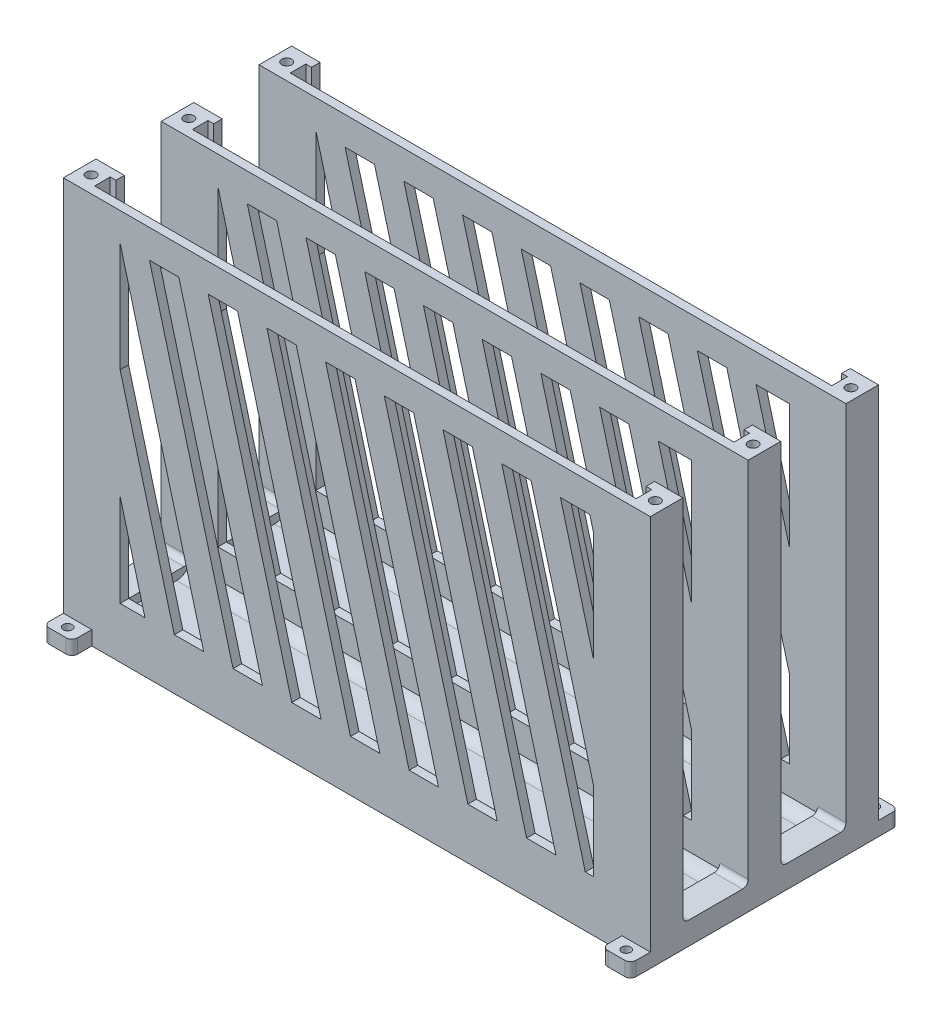
from build123d import *

# Parameters (mm, degrees)
SKETCH1_W           = 187
SKETCH1_H           = 3
SKETCH1_W_2         = 10
SKETCH1_H_2         = 23
BOSS_EXTRUDE1_DEPTH = 3.2
BOSS_EXTRUDE2_DEPTH = 130
BOSS_EXTRUDE3_START = -3
SKETCH1_5_W         = 187
SKETCH1_5_H         = 3
SKETCH1_5_W_2       = 10
SKETCH1_5_H_2       = 23
SKETCH1_5_R         = 1.6
BOSS_EXTRUDE3_DEPTH = 5
FILLET1_R           = 5
SKETCH2_R           = 1.75
CUT_EXTRUDE1_DEPTH  = 5
FILLET2_R           = 2
BOSS_EXTRUDE4_START = -3
SKETCH3_W           = 187
SKETCH3_H           = 130
BOSS_EXTRUDE4_DEPTH = 3
BOSS_EXTRUDE5_DEPTH = 3
LPATTERN1_COUNT     = 2
LPATTERN1_PITCH     = 34.5


with BuildPart() as part:
    # Sketch1 → Boss-Extrude1 (new body)
    with BuildSketch(Plane(origin=(0, 0, 0), x_dir=(1, 0, 0), z_dir=(0, 1, 0))):
        Polygon((-103.5, -74.75), (-93.5, -74.75), (-93.5, -71.75), (-95.5, -71.75), (-95.5, -66.25), (-93.5, -66.25), (-93.5, -63.25), (-103.5, -63.25), align=None)
        with Locations((0, -73.25)):
            Rectangle(SKETCH1_W, SKETCH1_H)
        with Locations((0, -64.75)):
            Rectangle(SKETCH1_W, SKETCH1_H)
        with Locations((0, -38.75)):
            Rectangle(SKETCH1_W, SKETCH1_H)
        Polygon((-103.5, -40.25), (-93.5, -40.25), (-93.5, -37.25), (-95.5, -37.25), (-95.5, -31.75), (-93.5, -31.75), (-93.5, -28.75), (-103.5, -28.75), align=None)
        with Locations((0, -30.25)):
            Rectangle(SKETCH1_W, SKETCH1_H)
        with Locations((0, -4.25)):
            Rectangle(SKETCH1_W, SKETCH1_H)
        with Locations((0, 4.25)):
            Rectangle(SKETCH1_W, SKETCH1_H)
        Polygon((93.5, -2.75), (95.5, -2.75), (95.5, 2.75), (93.5, 2.75), (93.5, 5.75), (103.5, 5.75), (103.5, -5.75), (93.5, -5.75), align=None)
        Polygon((103.5, -40.25), (93.5, -40.25), (93.5, -37.25), (95.5, -37.25), (95.5, -31.75), (93.5, -31.75), (93.5, -28.75), (103.5, -28.75), align=None)
        Polygon((103.5, -74.75), (93.5, -74.75), (93.5, -71.75), (95.5, -71.75), (95.5, -66.25), (93.5, -66.25), (93.5, -63.25), (103.5, -63.25), align=None)
        Polygon((-93.5, -5.75), (-93.5, -2.75), (-95.5, -2.75), (-95.5, 2.75), (-93.5, 2.75), (-93.5, 5.75), (-103.5, 5.75), (-103.5, -5.75), align=None)
        with Locations((-98.5, -51.75)):
            Rectangle(SKETCH1_W_2, SKETCH1_H_2)
        with Locations((-98.5, -17.25)):
            Rectangle(SKETCH1_W_2, SKETCH1_H_2)
        with Locations((98.5, -51.75)):
            Rectangle(SKETCH1_W_2, SKETCH1_H_2)
        with Locations((98.5, -17.25)):
            Rectangle(SKETCH1_W_2, SKETCH1_H_2)
    extrude(amount=-BOSS_EXTRUDE1_DEPTH)

    # Sketch1<4> → Boss-Extrude2 (add)
    with BuildSketch(Plane(origin=(0, 0, 0), x_dir=(1, 0, 0), z_dir=(0, 1, 0))):
        Polygon((-103.5, -74.75), (-93.5, -74.75), (-93.5, -71.75), (-95.5, -71.75), (-95.5, -66.25), (-93.5, -66.25), (-93.5, -63.25), (-103.5, -63.25), align=None)
        Polygon((-103.5, -40.25), (-93.5, -40.25), (-93.5, -37.25), (-95.5, -37.25), (-95.5, -31.75), (-93.5, -31.75), (-93.5, -28.75), (-103.5, -28.75), align=None)
        Polygon((-93.5, -5.75), (-93.5, -2.75), (-95.5, -2.75), (-95.5, 2.75), (-93.5, 2.75), (-93.5, 5.75), (-103.5, 5.75), (-103.5, -5.75), align=None)
        Polygon((103.5, -74.75), (93.5, -74.75), (93.5, -71.75), (95.5, -71.75), (95.5, -66.25), (93.5, -66.25), (93.5, -63.25), (103.5, -63.25), align=None)
        Polygon((103.5, -40.25), (93.5, -40.25), (93.5, -37.25), (95.5, -37.25), (95.5, -31.75), (93.5, -31.75), (93.5, -28.75), (103.5, -28.75), align=None)
        Polygon((93.5, -2.75), (95.5, -2.75), (95.5, 2.75), (93.5, 2.75), (93.5, 5.75), (103.5, 5.75), (103.5, -5.75), (93.5, -5.75), align=None)
    extrude(amount=BOSS_EXTRUDE2_DEPTH)

    # Sketch1<5> → Boss-Extrude3 (add)
    # profile 1 of 25: a face of its own
    with BuildSketch(Plane(origin=(0, 0, 0), x_dir=(1, 0, 0), z_dir=(0, 1, 0)).offset(BOSS_EXTRUDE3_START)):
        Polygon((-103.5, -74.75), (-93.5, -74.75), (-93.5, -71.75), (-95.5, -71.75), (-95.5, -66.25), (-93.5, -66.25), (-93.5, -63.25), (-103.5, -63.25), align=None)
    # profile 2 of 25: a face of its own
    with BuildSketch(Plane(origin=(0, 0, 0), x_dir=(1, 0, 0), z_dir=(0, 1, 0)).offset(BOSS_EXTRUDE3_START)):
        with Locations((0, -73.25)):
            Rectangle(SKETCH1_5_W, SKETCH1_5_H)
    # profile 3 of 25: a face of its own
    with BuildSketch(Plane(origin=(0, 0, 0), x_dir=(1, 0, 0), z_dir=(0, 1, 0)).offset(BOSS_EXTRUDE3_START)):
        Polygon((-93.5, -71.75), (-95.5, -71.75), (-95.5, -66.25), (-93.5, -66.25), (93.5, -66.25), (95.5, -66.25), (95.5, -71.75), (93.5, -71.75), align=None)
    # profile 4 of 25: a face of its own
    with BuildSketch(Plane(origin=(0, 0, 0), x_dir=(1, 0, 0), z_dir=(0, 1, 0)).offset(BOSS_EXTRUDE3_START)):
        with Locations((0, -64.75)):
            Rectangle(SKETCH1_5_W, SKETCH1_5_H)
    # profile 5 of 25: a face of its own
    with BuildSketch(Plane(origin=(0, 0, 0), x_dir=(1, 0, 0), z_dir=(0, 1, 0)).offset(BOSS_EXTRUDE3_START)):
        with Locations((-98.5, -51.75)):
            Rectangle(SKETCH1_5_W_2, SKETCH1_5_H_2)
    # profile 6 of 25: a face of its own
    with BuildSketch(Plane(origin=(0, 0, 0), x_dir=(1, 0, 0), z_dir=(0, 1, 0)).offset(BOSS_EXTRUDE3_START)):
        Polygon((-103.5, -40.25), (-93.5, -40.25), (-93.5, -37.25), (-95.5, -37.25), (-95.5, -31.75), (-93.5, -31.75), (-93.5, -28.75), (-103.5, -28.75), align=None)
    # profile 7 of 25: a face of its own
    with BuildSketch(Plane(origin=(0, 0, 0), x_dir=(1, 0, 0), z_dir=(0, 1, 0)).offset(BOSS_EXTRUDE3_START)):
        with Locations((0, -38.75)):
            Rectangle(SKETCH1_5_W, SKETCH1_5_H)
    # profile 8 of 25: a face of its own
    with BuildSketch(Plane(origin=(0, 0, 0), x_dir=(1, 0, 0), z_dir=(0, 1, 0)).offset(BOSS_EXTRUDE3_START)):
        with Locations((0, -30.25)):
            Rectangle(SKETCH1_5_W, SKETCH1_5_H)
    # profile 9 of 25: a face of its own
    with BuildSketch(Plane(origin=(0, 0, 0), x_dir=(1, 0, 0), z_dir=(0, 1, 0)).offset(BOSS_EXTRUDE3_START)):
        with Locations((-98.5, -17.25)):
            Rectangle(SKETCH1_5_W_2, SKETCH1_5_H_2)
    # profile 10 of 25: a face of its own
    with BuildSketch(Plane(origin=(0, 0, 0), x_dir=(1, 0, 0), z_dir=(0, 1, 0)).offset(BOSS_EXTRUDE3_START)):
        Polygon((-93.5, -5.75), (-93.5, -2.75), (-95.5, -2.75), (-95.5, 2.75), (-93.5, 2.75), (-93.5, 5.75), (-103.5, 5.75), (-103.5, -5.75), align=None)
    # profile 11 of 25: a face of its own
    with BuildSketch(Plane(origin=(0, 0, 0), x_dir=(1, 0, 0), z_dir=(0, 1, 0)).offset(BOSS_EXTRUDE3_START)):
        with Locations((0, -4.25)):
            Rectangle(SKETCH1_5_W, SKETCH1_5_H)
    # profile 12 of 25: a face of its own
    with BuildSketch(Plane(origin=(0, 0, 0), x_dir=(1, 0, 0), z_dir=(0, 1, 0)).offset(BOSS_EXTRUDE3_START)):
        with Locations((0, 4.25)):
            Rectangle(SKETCH1_5_W, SKETCH1_5_H)
    # profile 13 of 25: a face of its own
    with BuildSketch(Plane(origin=(0, 0, 0), x_dir=(1, 0, 0), z_dir=(0, 1, 0)).offset(BOSS_EXTRUDE3_START)):
        Polygon((93.5, -2.75), (95.5, -2.75), (95.5, 2.75), (93.5, 2.75), (93.5, 5.75), (103.5, 5.75), (103.5, -5.75), (93.5, -5.75), align=None)
    # profile 14 of 25: a face of its own
    with BuildSketch(Plane(origin=(0, 0, 0), x_dir=(1, 0, 0), z_dir=(0, 1, 0)).offset(BOSS_EXTRUDE3_START)):
        with Locations((98.5, -17.25)):
            Rectangle(SKETCH1_5_W_2, SKETCH1_5_H_2)
    # profile 15 of 25: a face of its own
    with BuildSketch(Plane(origin=(0, 0, 0), x_dir=(1, 0, 0), z_dir=(0, 1, 0)).offset(BOSS_EXTRUDE3_START)):
        Polygon((103.5, -40.25), (93.5, -40.25), (93.5, -37.25), (95.5, -37.25), (95.5, -31.75), (93.5, -31.75), (93.5, -28.75), (103.5, -28.75), align=None)
    # profile 16 of 25: a face of its own
    with BuildSketch(Plane(origin=(0, 0, 0), x_dir=(1, 0, 0), z_dir=(0, 1, 0)).offset(BOSS_EXTRUDE3_START)):
        with Locations((98.5, -51.75)):
            Rectangle(SKETCH1_5_W_2, SKETCH1_5_H_2)
    # profile 17 of 25: a face of its own
    with BuildSketch(Plane(origin=(0, 0, 0), x_dir=(1, 0, 0), z_dir=(0, 1, 0)).offset(BOSS_EXTRUDE3_START)):
        Polygon((103.5, -74.75), (93.5, -74.75), (93.5, -71.75), (95.5, -71.75), (95.5, -66.25), (93.5, -66.25), (93.5, -63.25), (103.5, -63.25), align=None)
    # profile 18 of 25: a face of its own
    with BuildSketch(Plane(origin=(0, 0, 0), x_dir=(1, 0, 0), z_dir=(0, 1, 0)).offset(BOSS_EXTRUDE3_START)):
        Polygon((-93.5, -37.25), (-95.5, -37.25), (-95.5, -31.75), (-93.5, -31.75), (93.5, -31.75), (95.5, -31.75), (95.5, -37.25), (93.5, -37.25), align=None)
    # profile 19 of 25: a face of its own
    with BuildSketch(Plane(origin=(0, 0, 0), x_dir=(1, 0, 0), z_dir=(0, 1, 0)).offset(BOSS_EXTRUDE3_START)):
        Polygon((95.5, 2.75), (93.5, 2.75), (-93.5, 2.75), (-95.5, 2.75), (-95.5, -2.75), (-93.5, -2.75), (93.5, -2.75), (95.5, -2.75), align=None)
    # profile 20 of 25: a face of its own
    with BuildSketch(Plane(origin=(0, 0, 0), x_dir=(1, 0, 0), z_dir=(0, 1, 0)).offset(BOSS_EXTRUDE3_START)):
        with Locations((0, -51.75)):
            Rectangle(SKETCH1_5_W, SKETCH1_5_H_2)
    # profile 21 of 25: a face of its own
    with BuildSketch(Plane(origin=(0, 0, 0), x_dir=(1, 0, 0), z_dir=(0, 1, 0)).offset(BOSS_EXTRUDE3_START)):
        with Locations((0, -17.25)):
            Rectangle(SKETCH1_5_W, SKETCH1_5_H_2)
    # profile 22 of 25: a face of its own
    with BuildSketch(Plane(origin=(0, 0, 0), x_dir=(1, 0, 0), z_dir=(0, 1, 0)).offset(BOSS_EXTRUDE3_START)):
        with BuildLine():
            ThreePointArc((-101.5, -81.75), (-102.914213562, -81.164213562), (-103.5, -79.75))
            Line((-103.5, -79.75), (-103.5, -74.75))
            Line((-103.5, -74.75), (-93.5, -74.75))
            Line((-93.5, -74.75), (-93.5, -79.75))
            ThreePointArc((-93.5, -79.75), (-94.085786438, -81.164213562), (-95.5, -81.75))
            Line((-95.5, -81.75), (-101.5, -81.75))
        make_face()
        with Locations(Location((-98.5, -78.25, 0), (0, 0, 270))):
            Circle(SKETCH1_5_R, mode=Mode.SUBTRACT)
    # profile 23 of 25: a face of its own
    with BuildSketch(Plane(origin=(0, 0, 0), x_dir=(1, 0, 0), z_dir=(0, 1, 0)).offset(BOSS_EXTRUDE3_START)):
        with BuildLine():
            ThreePointArc((95.5, -81.75), (94.085786438, -81.164213562), (93.5, -79.75))
            Line((93.5, -79.75), (93.5, -74.75))
            Line((93.5, -74.75), (103.5, -74.75))
            Line((103.5, -74.75), (103.5, -79.75))
            ThreePointArc((103.5, -79.75), (102.914213562, -81.164213562), (101.5, -81.75))
            Line((101.5, -81.75), (95.5, -81.75))
        make_face()
        with Locations(Location((98.5, -78.25, 0), (0, 0, 270))):
            Circle(SKETCH1_5_R, mode=Mode.SUBTRACT)
    # profile 24 of 25: a face of its own
    with BuildSketch(Plane(origin=(0, 0, 0), x_dir=(1, 0, 0), z_dir=(0, 1, 0)).offset(BOSS_EXTRUDE3_START)):
        with BuildLine():
            Line((103.5, 5.75), (103.5, 10.75))
            ThreePointArc((103.5, 10.75), (102.914213562, 12.164213562), (101.5, 12.75))
            Line((101.5, 12.75), (95.5, 12.75))
            ThreePointArc((95.5, 12.75), (94.085786438, 12.164213562), (93.5, 10.75))
            Line((93.5, 10.75), (93.5, 5.75))
            Line((93.5, 5.75), (103.5, 5.75))
        make_face()
        with Locations(Location((98.5, 9.25, 0), (0, 0, 270))):
            Circle(SKETCH1_5_R, mode=Mode.SUBTRACT)
    # profile 25 of 25: a face of its own
    with BuildSketch(Plane(origin=(0, 0, 0), x_dir=(1, 0, 0), z_dir=(0, 1, 0)).offset(BOSS_EXTRUDE3_START)):
        with BuildLine():
            ThreePointArc((-103.5, 10.75), (-102.914213562, 12.164213562), (-101.5, 12.75))
            Line((-101.5, 12.75), (-95.5, 12.75))
            ThreePointArc((-95.5, 12.75), (-94.085786438, 12.164213562), (-93.5, 10.75))
            Line((-93.5, 10.75), (-93.5, 5.75))
            Line((-93.5, 5.75), (-103.5, 5.75))
            Line((-103.5, 5.75), (-103.5, 10.75))
        make_face()
        with Locations(Location((-98.5, 9.25, 0), (0, 0, 270))):
            Circle(SKETCH1_5_R, mode=Mode.SUBTRACT)
    extrude(amount=-BOSS_EXTRUDE3_DEPTH)

    # Fillet1
    # the kernel refuses this fillet: 5 mm, written as the material it adds along each edge
    with BuildSketch(Plane(origin=(-104.956439237, -3, 5.75), x_dir=(0, 0, 1), z_dir=(1, 0, 0))) as fillet1_piece_1_section:
        with BuildLine():
            CenterArc((4.582575695, -5), FILLET1_R, 90, 66.421821522)
            Line((0, -3), (-0.091651514, -2.96))
            ThreePointArc((-0.091651514, -2.96), (-0.1, -1.5), (-0.1, 0))
            Line((-0.1, 0), (0, 0.1))
            Line((0, 0.1), (4.582575695, 0.1))
            Line((4.582575695, 0.1), (4.582575695, 0))
        make_face()
    fillet1_piece_1 = extrude(amount=209.912878475, mode=Mode.PRIVATE)
    fillet1_piece_1 = split(fillet1_piece_1, bisect_by=Plane(origin=(-103.5, -2.224183561, 6.865937721), z_dir=(1, 0, 0)), keep=Keep.TOP, mode=Mode.PRIVATE)
    fillet1_piece_1 = split(fillet1_piece_1, bisect_by=Plane(origin=(103.5, -2.224183561, 6.865937721), z_dir=(-1, 0, 0)), keep=Keep.TOP, mode=Mode.PRIVATE)
    add(fillet1_piece_1)
    with BuildSketch(Plane(origin=(-104.956439237, -3, 40.25), x_dir=(0, 0, 1), z_dir=(1, 0, 0))) as fillet1_piece_2_section:
        with BuildLine():
            CenterArc((4.582575695, -5), FILLET1_R, 90, 66.421821522)
            Line((0, -3), (-0.091651514, -2.96))
            ThreePointArc((-0.091651514, -2.96), (-0.1, -1.5), (-0.1, 0))
            Line((-0.1, 0), (0, 0.1))
            Line((0, 0.1), (4.582575695, 0.1))
            Line((4.582575695, 0.1), (4.582575695, 0))
        make_face()
    fillet1_piece_2 = extrude(amount=209.912878475, mode=Mode.PRIVATE)
    fillet1_piece_2 = split(fillet1_piece_2, bisect_by=Plane(origin=(-103.5, -2.224183561, 41.365937721), z_dir=(1, 0, 0)), keep=Keep.TOP, mode=Mode.PRIVATE)
    fillet1_piece_2 = split(fillet1_piece_2, bisect_by=Plane(origin=(103.5, -2.224183561, 41.365937721), z_dir=(-1, 0, 0)), keep=Keep.TOP, mode=Mode.PRIVATE)
    add(fillet1_piece_2)
    with BuildSketch(Plane(origin=(-104.956439237, -3, 28.75), x_dir=(0, 1, 0), z_dir=(1, 0, 0))) as fillet1_piece_3_section:
        with BuildLine():
            CenterArc((5, -4.582575695), FILLET1_R, 113.578178478, 66.421821522)
            Line((0, -4.582575695), (-0.1, -4.582575695))
            Line((-0.1, -4.582575695), (-0.1, 0))
            Line((-0.1, 0), (0, 0.1))
            ThreePointArc((0, 0.1), (1.5, 0.1), (2.96, 0.091651514))
            Line((2.96, 0.091651514), (3, 0))
        make_face()
    fillet1_piece_3 = extrude(amount=209.912878475, mode=Mode.PRIVATE)
    fillet1_piece_3 = split(fillet1_piece_3, bisect_by=Plane(origin=(-103.5, -2.224183561, 27.634062279), z_dir=(1, 0, 0)), keep=Keep.TOP, mode=Mode.PRIVATE)
    fillet1_piece_3 = split(fillet1_piece_3, bisect_by=Plane(origin=(103.5, -2.224183561, 27.634062279), z_dir=(-1, 0, 0)), keep=Keep.TOP, mode=Mode.PRIVATE)
    add(fillet1_piece_3)
    with BuildSketch(Plane(origin=(-104.956439237, -3, 63.25), x_dir=(0, 1, 0), z_dir=(1, 0, 0))) as fillet1_piece_4_section:
        with BuildLine():
            CenterArc((5, -4.582575695), FILLET1_R, 113.578178478, 66.421821522)
            Line((0, -4.582575695), (-0.1, -4.582575695))
            Line((-0.1, -4.582575695), (-0.1, 0))
            Line((-0.1, 0), (0, 0.1))
            ThreePointArc((0, 0.1), (1.5, 0.1), (2.96, 0.091651514))
            Line((2.96, 0.091651514), (3, 0))
        make_face()
    fillet1_piece_4 = extrude(amount=209.912878475, mode=Mode.PRIVATE)
    fillet1_piece_4 = split(fillet1_piece_4, bisect_by=Plane(origin=(-103.5, -2.224183561, 62.134062279), z_dir=(1, 0, 0)), keep=Keep.TOP, mode=Mode.PRIVATE)
    fillet1_piece_4 = split(fillet1_piece_4, bisect_by=Plane(origin=(103.5, -2.224183561, 62.134062279), z_dir=(-1, 0, 0)), keep=Keep.TOP, mode=Mode.PRIVATE)
    add(fillet1_piece_4)

    # Sketch2 → Cut-Extrude1 (cut)
    with BuildSketch(Plane(origin=(0, 130, 0), x_dir=(1, 0, 0), z_dir=(0, 1, 0))):
        with Locations(Location((-99.5, 0, 0), (0, 0, 270))):
            Circle(SKETCH2_R)
        with Locations(Location((99.5, 0, 0), (0, 0, 90))):
            Circle(SKETCH2_R)
        with Locations(Location((-99.5, -34.5, 0), (0, 0, 270))):
            Circle(SKETCH2_R)
        with Locations(Location((99.5, -34.5, 0), (0, 0, 90))):
            Circle(SKETCH2_R)
        with Locations(Location((-99.5, -69, 0), (0, 0, 270))):
            Circle(SKETCH2_R)
        with Locations(Location((99.5, -69, 0), (0, 0, 90))):
            Circle(SKETCH2_R)
    extrude(amount=-CUT_EXTRUDE1_DEPTH, mode=Mode.SUBTRACT)

    # Fillet2
    # the kernel refuses this fillet: 2 mm, written as the material it adds along each edge
    with BuildSketch(Plane(origin=(-103.5, 0, 40.25), x_dir=(0, 0, 1), z_dir=(1, 0, 0)), Plane(origin=(-103.5, 0, 5.75), x_dir=(0, 0, 1), z_dir=(1, 0, 0)), Plane(origin=(93.5, 0, 63.25), x_dir=(0, 1, 0), z_dir=(1, 0, 0)), Plane(origin=(93.5, 0, 28.75), x_dir=(0, 1, 0), z_dir=(1, 0, 0))) as fillet2_piece_1:
        with BuildLine():
            CenterArc((FILLET2_R, -FILLET2_R), FILLET2_R, 90, 90)
            Line((0, -FILLET2_R), (0, 0))
            Line((0, 0), (FILLET2_R, 0))
        make_face()
    extrude(amount=10)
    with BuildSketch(Plane(origin=(-93.5, 0, 28.75), x_dir=(0, 1, 0), z_dir=(-1, 0, 0)), Plane(origin=(103.5, 0, 40.25), x_dir=(0, 0, 1), z_dir=(-1, 0, 0)), Plane(origin=(103.5, 0, 5.75), x_dir=(0, 0, 1), z_dir=(-1, 0, 0)), Plane(origin=(-93.5, 0, 63.25), x_dir=(0, 1, 0), z_dir=(-1, 0, 0))) as fillet2_piece_2:
        with BuildLine():
            CenterArc((FILLET2_R, FILLET2_R), FILLET2_R, 180, 90)
            Line((0, FILLET2_R), (0, 0))
            Line((0, 0), (FILLET2_R, 0))
        make_face()
    extrude(amount=10)

    # Sketch3 → Boss-Extrude4 (add)
    with BuildSketch(Plane.XY.offset(74.75).offset(BOSS_EXTRUDE4_START)):
        with Locations((0, 65)):
            Rectangle(SKETCH3_W, SKETCH3_H)
        Polygon((-83.5, 10), (-83.5, 42.725933897), (-74.731112441, 10), align=None, mode=Mode.SUBTRACT)
        Polygon((-83.5, 120), (-54.025588833, 10), (-64.378350637, 10), (-83.5, 81.362966948), align=None, mode=Mode.SUBTRACT)
        Polygon((-43.672827028, 10), (-73.147238196, 120), (-62.794476392, 120), (-33.320065224, 10), align=None, mode=Mode.SUBTRACT)
        Polygon((-52.441714588, 120), (-42.088952784, 120), (-12.614541616, 10), (-22.96730342, 10), align=None, mode=Mode.SUBTRACT)
        Polygon((-31.736190979, 120), (-21.383429175, 120), (8.090981992, 10), (-2.261779812, 10), align=None, mode=Mode.SUBTRACT)
        Polygon((-11.030667371, 120), (-0.677905567, 120), (28.7965056, 10), (18.443743796, 10), align=None, mode=Mode.SUBTRACT)
        Polygon((9.674856237, 120), (20.027618041, 120), (49.502029208, 10), (39.149267404, 10), align=None, mode=Mode.SUBTRACT)
        Polygon((30.380379845, 120), (40.733141649, 120), (70.207552817, 10), (59.854791013, 10), align=None, mode=Mode.SUBTRACT)
        Polygon((51.085903453, 120), (61.438665257, 120), (83.5, 37.665977858), (83.5, 10), (80.560314621, 10), align=None, mode=Mode.SUBTRACT)
        Polygon((71.791427062, 120), (82.144188866, 120), (83.5, 114.940043961), (83.5, 76.303010909), align=None, mode=Mode.SUBTRACT)
    extrude(amount=BOSS_EXTRUDE4_DEPTH)

    # Sketch4 → Boss-Extrude5 (add)
    with BuildSketch(Plane.XY.offset(40.25)):
        Polygon((93.5, 130), (-93.5, 130), (-93.5, 0), (93.5, 0), (93.5, 116.256568937), align=None)
        Polygon((-83.5, 10), (-83.5, 42.725933897), (-74.731112441, 10), align=None, mode=Mode.SUBTRACT)
        Polygon((-83.5, 120), (-54.025588833, 10), (-64.378350637, 10), (-83.5, 81.362966948), align=None, mode=Mode.SUBTRACT)
        Polygon((-43.672827028, 10), (-73.147238196, 120), (-62.794476392, 120), (-33.320065224, 10), align=None, mode=Mode.SUBTRACT)
        Polygon((-52.441714588, 120), (-42.088952784, 120), (-12.614541616, 10), (-22.96730342, 10), align=None, mode=Mode.SUBTRACT)
        Polygon((-31.736190979, 120), (-21.383429175, 120), (8.090981992, 10), (-2.261779812, 10), align=None, mode=Mode.SUBTRACT)
        Polygon((-11.030667371, 120), (-0.677905567, 120), (28.7965056, 10), (18.443743796, 10), align=None, mode=Mode.SUBTRACT)
        Polygon((9.674856237, 120), (20.027618041, 120), (49.502029208, 10), (39.149267404, 10), align=None, mode=Mode.SUBTRACT)
        Polygon((30.380379845, 120), (40.733141649, 120), (70.207552817, 10), (59.854791013, 10), align=None, mode=Mode.SUBTRACT)
        Polygon((51.085903453, 120), (61.438665257, 120), (83.5, 37.665977858), (83.5, 10), (80.560314621, 10), align=None, mode=Mode.SUBTRACT)
        Polygon((71.791427062, 120), (83.5, 120), (83.5, 76.303010909), align=None, mode=Mode.SUBTRACT)
    boss_extrude5 = extrude(amount=-BOSS_EXTRUDE5_DEPTH)

    # LPattern1: Boss-Extrude5 ×2
    with Locations(*[(0, 0, -i * LPATTERN1_PITCH) for i in range(1, LPATTERN1_COUNT)]):
        add(boss_extrude5)


solid = part.part
